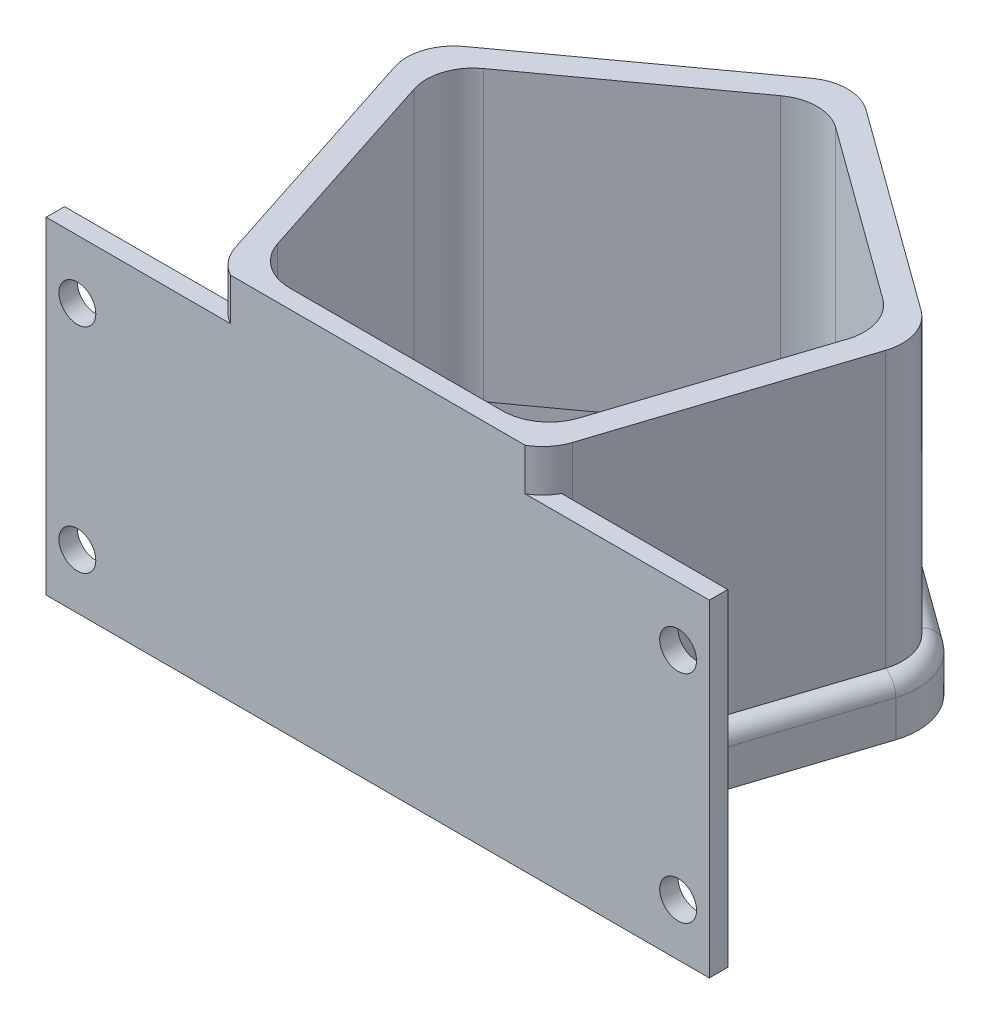
from build123d import *

# Parameters (mm, degrees)
SKETCH1_W                = 45.72
SKETCH1_H                = 25.4
BOSS_EXTRUDE1_DEPTH      = 4
BOSS_EXTRUDE2_DEPTH      = 25.4
FILLET1_R                = 7.62
BOSS_EXTRUDE3_DEPTH      = 5.08
BOSS_EXTRUDE4_DEPTH      = 6.35
BOSS_EXTRUDE4_DEPTH_BACK = 2.159
BOSS_EXTRUDE5_START      = -8.509
BOSS_EXTRUDE5_DEPTH      = 8.509
CUT_EXTRUDE4_DEPTH       = 12.192
FILLET5_R                = 5.715
FILLET6_R                = 2.54
BOSS_EXTRUDE6_DEPTH      = 16.51
BOSS_EXTRUDE7_START      = -40.14
SKETCH23_W               = 108
SKETCH23_H               = 3
BOSS_EXTRUDE7_DEPTH      = 46.49
CUT_EXTRUDE10_DEPTH      = 105.433406107
CUT_EXTRUDE10_DEPTH_BACK = 105.433406107
SKETCH24_W               = 66.644686686
SKETCH24_H               = 9.540314428
SKETCH27_W               = 108
SKETCH27_H               = 3
BOSS_EXTRUDE9_DEPTH      = 6.8
CUT_EXTRUDE11_DEPTH      = 102.682486179
CUT_EXTRUDE11_DEPTH_BACK = 3
SKETCH28_R               = 3


with BuildPart() as part:
    # Sketch1 → Boss-Extrude1 (new body)
    with BuildSketch(Plane.XY):
        Rectangle(SKETCH1_W, SKETCH1_H)
    extrude(amount=BOSS_EXTRUDE1_DEPTH)

    # Sketch2 → Boss-Extrude2 (add)
    with BuildSketch(Plane(origin=(0, 12.7, 0), x_dir=(1, 0, 0), z_dir=(0, 1, 0))):
        Polygon((36.988256983, 43.482303925), (22.86, 0), (22.86, -4), (25.766170112, -4), (41.690539001, 45.01016797), (0, 75.30011757), (-41.690539001, 45.01016797), (-25.766170112, -4), (-22.86, -4), (-22.86, 0), (-36.988256983, 43.482303925), (0, 70.35584566), align=None)
    extrude(amount=-BOSS_EXTRUDE2_DEPTH)

    # Fillet1
    fillet1_edges = [part.edges().sort_by_distance(p)[0] for p in [
        (0, 0, -75.30011757),
        (41.690539001, 0, -45.01016797),
        (25.766170112, 0, 4),
        (36.988256983, 0, -43.482303925),
        (0, 0, -70.35584566),
        (-36.988256983, 0, -43.482303925),
        (-25.766170112, 0, 4),
        (-41.690539001, 0, -45.01016797),
        (-22.86, 0, 0),
        (22.86, 0, 0),
    ]]
    fillet(fillet1_edges, radius=FILLET1_R)

    # Sketch6 → Boss-Extrude3 (add)
    with BuildSketch(Plane(origin=(0, 12.7, 0), x_dir=(1, 0, 0), z_dir=(0, 1, 0))):
        with BuildLine():
            Line((-20.229916049, -4), (20.229916049, -4))
            ThreePointArc((20.229916049, -4), (24.708839671, -2.544709497), (27.476966703, 1.265290503))
            Line((27.476966703, 1.265290503), (39.97974241, 39.744877467))
            ThreePointArc((39.97974241, 39.744877467), (39.97974241, 44.454296461), (37.211615379, 48.264296461))
            Line((37.211615379, 48.264296461), (4.478923622, 72.045989078))
            ThreePointArc((4.478923622, 72.045989078), (0, 73.501279581), (-4.478923622, 72.045989078))
            Line((-4.478923622, 72.045989078), (-37.211615379, 48.264296461))
            ThreePointArc((-37.211615379, 48.264296461), (-39.97974241, 44.454296461), (-39.97974241, 39.744877467))
            Line((-39.97974241, 39.744877467), (-27.476966703, 1.265290503))
            ThreePointArc((-27.476966703, 1.265290503), (-24.708839671, -2.544709497), (-20.229916049, -4))
        make_face()
        with BuildLine():
            Line((24.570796591, 5.265290503), (35.277460392, 38.217013422))
            ThreePointArc((35.277460392, 38.217013422), (35.277460392, 42.926432416), (32.50933336, 46.736432416))
            Line((32.50933336, 46.736432416), (4.478923622, 67.101717168))
            ThreePointArc((4.478923622, 67.101717168), (0, 68.557007671), (-4.478923622, 67.101717168))
            Line((-4.478923622, 67.101717168), (-32.50933336, 46.736432416))
            ThreePointArc((-32.50933336, 46.736432416), (-35.277460392, 42.926432416), (-35.277460392, 38.217013422))
            Line((-35.277460392, 38.217013422), (-24.570796591, 5.265290503))
            ThreePointArc((-24.570796591, 5.265290503), (-21.802669559, 1.455290503), (-17.323745937, 0))
            Line((-17.323745937, 0), (17.323745937, 0))
            ThreePointArc((17.323745937, 0), (21.802669559, 1.455290503), (24.570796591, 5.265290503))
        make_face(mode=Mode.SUBTRACT)
    extrude(amount=BOSS_EXTRUDE3_DEPTH)

    # Sketch8 → Boss-Extrude4 (add, two sides: drawn at the far end of the back side and taken through both)
    with BuildSketch(Plane.XZ.offset(12.7).offset(-BOSS_EXTRUDE4_DEPTH_BACK)):
        with BuildLine():
            Line((5.971898163, -74.100892244), (38.70458992, -50.319199627))
            ThreePointArc((38.70458992, -50.319199627), (42.395425962, -45.239199627), (42.395425962, -38.959974301))
            Line((42.395425962, -38.959974301), (29.892650254, -0.480387337))
            ThreePointArc((29.892650254, -0.480387337), (26.201814212, 4.599612663), (20.229916049, 6.54))
            Line((20.229916049, 6.54), (-20.229916049, 6.54))
            ThreePointArc((-20.229916049, 6.54), (-26.201814212, 4.599612663), (-29.892650254, -0.480387337))
            Line((-29.892650254, -0.480387337), (-42.395425962, -38.959974301))
            ThreePointArc((-42.395425962, -38.959974301), (-42.395425962, -45.239199627), (-38.70458992, -50.319199627))
            Line((-38.70458992, -50.319199627), (-5.971898163, -74.100892244))
            ThreePointArc((-5.971898163, -74.100892244), (0, -76.041279581), (5.971898163, -74.100892244))
        make_face()
        with BuildLine():
            Line((39.97974241, -39.744877467), (27.476966703, -1.265290503))
            ThreePointArc((27.476966703, -1.265290503), (24.708839671, 2.544709497), (20.229916049, 4))
            Line((20.229916049, 4), (-20.229916049, 4))
            ThreePointArc((-20.229916049, 4), (-24.708839671, 2.544709497), (-27.476966703, -1.265290503))
            Line((-27.476966703, -1.265290503), (-39.97974241, -39.744877467))
            ThreePointArc((-39.97974241, -39.744877467), (-39.97974241, -44.454296461), (-37.211615379, -48.264296461))
            Line((-37.211615379, -48.264296461), (-4.478923622, -72.045989078))
            ThreePointArc((-4.478923622, -72.045989078), (0, -73.501279581), (4.478923622, -72.045989078))
            Line((4.478923622, -72.045989078), (37.211615379, -48.264296461))
            ThreePointArc((37.211615379, -48.264296461), (39.97974241, -44.454296461), (39.97974241, -39.744877467))
        make_face(mode=Mode.SUBTRACT)
    extrude(amount=BOSS_EXTRUDE4_DEPTH + BOSS_EXTRUDE4_DEPTH_BACK)

    # Sketch11 → Boss-Extrude5 (add)
    with BuildSketch(Plane.XZ.offset(19.05).offset(BOSS_EXTRUDE5_START)):
        with BuildLine():
            Line((19.948787859, 5.414930333), (27.190045273, 1.56775587))
            Line((27.190045273, 1.56775587), (29.892650254, -0.480387337))
            ThreePointArc((29.892650254, -0.480387337), (26.201814212, 4.599612663), (20.229916049, 6.54))
            Line((20.229916049, 6.54), (19.948787859, 5.414930333))
        make_face()
        with BuildLine():
            ThreePointArc((20.229916049, 6.54), (28.196740294, 7.345392854), (29.892650254, -0.480387337))
            ThreePointArc((29.892650254, -0.480387337), (26.201814212, 4.599612663), (20.229916049, 6.54))
        make_face()
    extrude(amount=BOSS_EXTRUDE5_DEPTH)

    # Sketch12 → Cut-Extrude4 (cut)
    with BuildSketch(Plane.XZ.offset(19.05)):
        with BuildLine():
            ThreePointArc((28.787792432, 0.145862767), (27.450253023, 6.317941272), (21.166935135, 5.682739694))
            ThreePointArc((21.166935135, 5.682739694), (25.637505825, 3.822908801), (28.787792432, 0.145862767))
        make_face()
    extrude(amount=-CUT_EXTRUDE4_DEPTH, mode=Mode.SUBTRACT)

    # Fillet5
    fillet5_edges = [part.edges().sort_by_distance(p)[0] for p in [
        (20.229916049, -14.7955, 6.54),
        (29.892650254, -14.7955, -0.480387337),
    ]]
    fillet(fillet5_edges, radius=FILLET5_R)

    # Fillet6
    # the kernel refuses this fillet: 2.54 mm, written as the material it takes off along each edge
    with BuildSketch(Plane(origin=(32.732691756, -10.541, -42.099586964), x_dir=(0.5877852522924727, 0, -0.8090169943749478), z_dir=(-0.8090169943749478, 0, -0.5877852522924727))) as fillet6_piece_1:
        with BuildLine():
            CenterArc((10.16 - FILLET6_R, FILLET6_R), FILLET6_R, 270, 90)
            Line((10.16 - FILLET6_R, 0), (10.16, 0))
            Line((10.16, 0), (10.16, FILLET6_R))
        make_face()
    revolve(axis=Axis((32.732691756, -10.541, -42.099586964), (0, -1, 0)), revolution_arc=72, mode=Mode.SUBTRACT)
    with BuildSketch(Plane(origin=(5.971898163, -10.541, -74.100892244), x_dir=(0, -1, 0), z_dir=(0.8090169943749487, 0, 0.5877852522924716)), Plane(origin=(-38.70458992, -10.541, -50.319199627), x_dir=(0, -1, 0), z_dir=(0.8090169943749469, 0, -0.5877852522924739)), Plane(origin=(-29.892650254, -10.541, -0.480387337), x_dir=(0, -1, 0), z_dir=(-0.30901699437495056, 0, -0.9510565162951526))) as fillet6_piece_2:
        with BuildLine():
            CenterArc((FILLET6_R, -FILLET6_R), FILLET6_R, 90, 90)
            Line((0, -FILLET6_R), (0, 0))
            Line((0, 0), (FILLET6_R, 0))
        make_face()
    extrude(amount=40.459832097, mode=Mode.SUBTRACT)
    with BuildSketch(Plane(origin=(0, -10.541, -65.881279581), x_dir=(-0.5877852522924719, 0, -0.8090169943749482), z_dir=(-0.8090169943749482, 0, 0.5877852522924719))) as fillet6_piece_3:
        with BuildLine():
            CenterArc((10.16 - FILLET6_R, FILLET6_R), FILLET6_R, 270, 90)
            Line((10.16 - FILLET6_R, 0), (10.16, 0))
            Line((10.16, 0), (10.16, FILLET6_R))
        make_face()
    revolve(axis=Axis((0, -10.541, -65.881279581), (0, -1, 0)), revolution_arc=72, mode=Mode.SUBTRACT)
    with BuildSketch(Plane(origin=(-32.732691756, -10.541, -42.099586964), x_dir=(-0.9510565162951528, 0, 0.3090169943749496), z_dir=(0.3090169943749496, 0, 0.9510565162951528))) as fillet6_piece_4:
        with BuildLine():
            CenterArc((10.16 - FILLET6_R, FILLET6_R), FILLET6_R, 270, 90)
            Line((10.16 - FILLET6_R, 0), (10.16, 0))
            Line((10.16, 0), (10.16, FILLET6_R))
        make_face()
    revolve(axis=Axis((-32.732691756, -10.541, -42.099586964), (0, -1, 0)), revolution_arc=72, mode=Mode.SUBTRACT)
    with BuildSketch(Plane(origin=(-20.229916049, -10.541, -3.62), x_dir=(0, 0, 1), z_dir=(1, 0, 0))) as fillet6_piece_5:
        with BuildLine():
            CenterArc((10.16 - FILLET6_R, FILLET6_R), FILLET6_R, 270, 90)
            Line((10.16 - FILLET6_R, 0), (10.16, 0))
            Line((10.16, 0), (10.16, FILLET6_R))
        make_face()
    revolve(axis=Axis((-20.229916049, -10.541, -3.62), (0, -1, 0)), revolution_arc=72, mode=Mode.SUBTRACT)
    with BuildSketch(Plane(origin=(18.184374257, -10.541, 6.54), x_dir=(0, -1, 0), z_dir=(-1, 0, 0)), Plane(origin=(42.395425962, -10.541, -38.959974301), x_dir=(0, -1, 0), z_dir=(-0.30901699437494484, 0, 0.9510565162951544))) as fillet6_piece_6:
        with BuildLine():
            CenterArc((FILLET6_R, -FILLET6_R), FILLET6_R, 90, 90)
            Line((0, -FILLET6_R), (0, 0))
            Line((0, 0), (FILLET6_R, 0))
        make_face()
    extrude(amount=38.414290306, mode=Mode.SUBTRACT)
    with BuildSketch(Plane(origin=(18.184374257, -10.541, 12.255), x_dir=(0.5526465683039506, 0, -0.8334157249187628), z_dir=(0.8334157249187628, 0, 0.5526465683039506))) as fillet6_piece_7:
        with BuildLine():
            CenterArc((5.715 + FILLET6_R, -FILLET6_R), FILLET6_R, 90, 90)
            Line((5.715 + FILLET6_R, 0), (5.715, 0))
            Line((5.715, 0), (5.715, -FILLET6_R))
        make_face()
    revolve(axis=Axis((18.184374257, -10.541, 12.255), (0, 1, 0)), revolution_arc=33.548768752, mode=Mode.SUBTRACT)
    with BuildSketch(Plane(origin=(35.960045421, -10.541, -0.659781065), x_dir=(-0.9510565162951543, 0, -0.30901699437494495), z_dir=(0.30901699437494495, 0, -0.9510565162951543))) as fillet6_piece_8:
        with BuildLine():
            CenterArc((5.715 + FILLET6_R, -FILLET6_R), FILLET6_R, 90, 90)
            Line((5.715 + FILLET6_R, 0), (5.715, 0))
            Line((5.715, 0), (5.715, -FILLET6_R))
        make_face()
    revolve(axis=Axis((35.960045421, -10.541, -0.659781065), (0, 1, 0)), revolution_arc=33.548768752, mode=Mode.SUBTRACT)
    with BuildSketch(Plane(origin=(24.664153166, -10.541, 2.483203799), x_dir=(-0.5526465683039513, 0, 0.8334157249187624), z_dir=(-0.8334157249187624, 0, -0.5526465683039513))) as fillet6_piece_9:
        with BuildLine():
            CenterArc((6.009996192 - FILLET6_R, -FILLET6_R), FILLET6_R, 0, 90)
            Line((6.009996192 - FILLET6_R, 0), (6.009996192, 0))
            Line((6.009996192, 0), (6.009996192, -FILLET6_R))
        make_face()
    revolve(axis=Axis((24.664153166, -10.541, 2.483203799), (0, 1, 0)), revolution_arc=139.097537505, mode=Mode.SUBTRACT)

    # Sketch15 → Boss-Extrude6 (add)
    with BuildSketch(Plane(origin=(0, 17.78, 0), x_dir=(1, 0, 0), z_dir=(0, 1, 0))):
        with BuildLine():
            Line((-20.229916049, -4), (20.229916049, -4))
            ThreePointArc((20.229916049, -4), (24.708839671, -2.544709497), (27.476966703, 1.265290503))
            Line((27.476966703, 1.265290503), (39.97974241, 39.744877467))
            ThreePointArc((39.97974241, 39.744877467), (39.97974241, 44.454296461), (37.211615379, 48.264296461))
            Line((37.211615379, 48.264296461), (4.478923622, 72.045989078))
            ThreePointArc((4.478923622, 72.045989078), (0, 73.501279581), (-4.478923622, 72.045989078))
            Line((-4.478923622, 72.045989078), (-37.211615379, 48.264296461))
            ThreePointArc((-37.211615379, 48.264296461), (-39.97974241, 44.454296461), (-39.97974241, 39.744877467))
            Line((-39.97974241, 39.744877467), (-27.476966703, 1.265290503))
            ThreePointArc((-27.476966703, 1.265290503), (-24.708839671, -2.544709497), (-20.229916049, -4))
        make_face()
        with BuildLine():
            Line((32.50933336, 46.736432416), (4.478923622, 67.101717168))
            ThreePointArc((4.478923622, 67.101717168), (0, 68.557007671), (-4.478923622, 67.101717168))
            Line((-4.478923622, 67.101717168), (-32.50933336, 46.736432416))
            ThreePointArc((-32.50933336, 46.736432416), (-35.277460392, 42.926432416), (-35.277460392, 38.217013422))
            Line((-35.277460392, 38.217013422), (-24.570796591, 5.265290503))
            ThreePointArc((-24.570796591, 5.265290503), (-21.802669559, 1.455290503), (-17.323745937, 0))
            Line((-17.323745937, 0), (17.323745937, 0))
            ThreePointArc((17.323745937, 0), (21.802669559, 1.455290503), (24.570796591, 5.265290503))
            Line((24.570796591, 5.265290503), (35.277460392, 38.217013422))
            ThreePointArc((35.277460392, 38.217013422), (35.277460392, 42.926432416), (32.50933336, 46.736432416))
        make_face(mode=Mode.SUBTRACT)
    extrude(amount=BOSS_EXTRUDE6_DEPTH)

    # Sketch23 → Boss-Extrude7 (add)
    with BuildSketch(Plane.XZ.offset(12.7).offset(BOSS_EXTRUDE7_START)):
        with Locations((0, 1.5)):
            Rectangle(SKETCH23_W, SKETCH23_H)
    extrude(amount=BOSS_EXTRUDE7_DEPTH)

    # Sketch24 → Cut-Extrude10 (cut, two sides: drawn at the far end of the back side and taken through both)
    with BuildSketch(Plane.XZ.offset(12.7).offset(-CUT_EXTRUDE10_DEPTH_BACK)):
        with Locations((1.37764771, 7.770157214)):
            Rectangle(SKETCH24_W, SKETCH24_H)
    extrude(amount=CUT_EXTRUDE10_DEPTH + CUT_EXTRUDE10_DEPTH_BACK, mode=Mode.SUBTRACT)

    # Sketch27 → Boss-Extrude9 (add)
    with BuildSketch(Plane.XZ.offset(19.05)):
        with Locations((0, 1.5)):
            Rectangle(SKETCH27_W, SKETCH27_H)
    extrude(amount=BOSS_EXTRUDE9_DEPTH)

    # Sketch28 → Cut-Extrude11 (cut, two sides: drawn at the far end of the back side and taken through both)
    with BuildSketch(Plane.XY.offset(3).offset(-CUT_EXTRUDE11_DEPTH_BACK)):
        with Locations((48.915, -17.35)):
            Circle(SKETCH28_R)
        with Locations((48.915, 17.85)):
            Circle(SKETCH28_R)
        with Locations((-48.915, -16.913045034)):
            Circle(SKETCH28_R)
        with Locations((-48.915, 17.85)):
            Circle(SKETCH28_R)
    extrude(amount=CUT_EXTRUDE11_DEPTH + CUT_EXTRUDE11_DEPTH_BACK, mode=Mode.SUBTRACT)


solid = part.part
